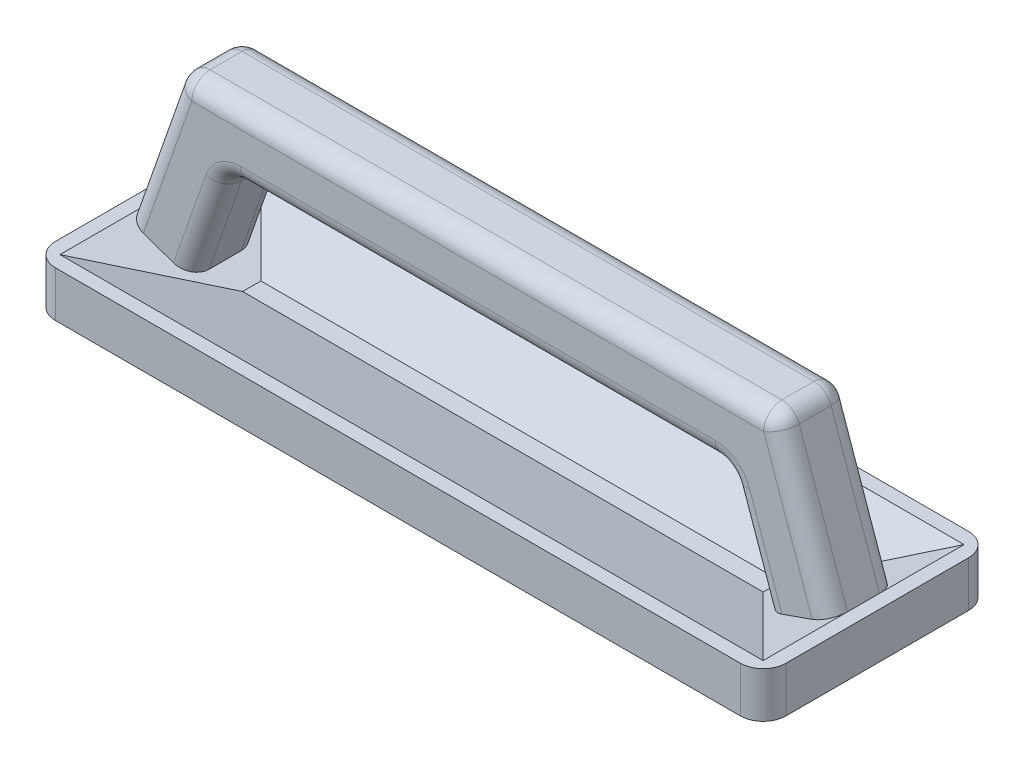
from build123d import *

# Parameters (mm, degrees)
SKETCH1_W                = 160
SKETCH1_H                = 50
BOSS_EXTRUDE1_DEPTH      = 10
SHELL3_T                 = -3
FILLET1_R                = 5
CHAMFER1_SIZE            = 7
CHAMFER1_SIZE_2          = 20
BOSS_EXTRUDE2_DEPTH      = 7.5
BOSS_EXTRUDE2_DEPTH_BACK = 7.5
FILLET2_R                = 4


with BuildPart() as part:
    # Sketch1 → Boss-Extrude1 (new body)
    with BuildSketch(Plane(origin=(0, 0, 0), x_dir=(1, 0, 0), z_dir=(0, 1, 0))):
        Rectangle(SKETCH1_W, SKETCH1_H)
    extrude(amount=BOSS_EXTRUDE1_DEPTH)

    # Shell3
    shell3_openings = [part.faces().sort_by_distance(p)[0] for p in [
        (0, 10, 0),
    ]]
    offset(amount=SHELL3_T, openings=shell3_openings, kind=Kind.INTERSECTION)

    # Fillet1
    fillet1_edges = [part.edges().sort_by_distance(p)[0] for p in [
        (80, 5, 25),
        (-80, 5, 25),
        (-80, 5, -25),
        (80, 5, -25),
    ]]
    fillet(fillet1_edges, radius=FILLET1_R)

    # Chamfer1
    # the kernel refuses this chamfer: 20, 7 mm, written as the material it adds along each edge
    with BuildSketch(Plane(origin=(-77, 3, 22), x_dir=(0, 0.9946410899892074, 0.10338811394488961), z_dir=(1, 0, 0))) as chamfer1_piece_1_section:
        Polygon((CHAMFER1_SIZE * 0.994641089989, -CHAMFER1_SIZE * 0.103388113945), (-CHAMFER1_SIZE_2 * 0.103388113945, -CHAMFER1_SIZE_2 * 0.994641089989), (0, 0), align=None)
    chamfer1_piece_1 = extrude(amount=154, mode=Mode.PRIVATE)
    chamfer1_piece_1 = split(chamfer1_piece_1, bisect_by=Plane(origin=(0, 10, 15.125023974), z_dir=(0, -1, 0)), keep=Keep.TOP, mode=Mode.PRIVATE)
    add(chamfer1_piece_1)
    with BuildSketch(Plane(origin=(-77, 3, -22), x_dir=(-0.10338811394489059, 0.9946410899892072, 0), z_dir=(0, 0, 1))) as chamfer1_piece_2_section:
        Polygon((CHAMFER1_SIZE * 0.994641089989, -CHAMFER1_SIZE * 0.103388113945), (-CHAMFER1_SIZE_2 * 0.103388113945, -CHAMFER1_SIZE_2 * 0.994641089989), (0, 0), align=None)
    chamfer1_piece_2 = extrude(amount=44, mode=Mode.PRIVATE)
    chamfer1_piece_2 = split(chamfer1_piece_2, bisect_by=Plane(origin=(-70.125023974, 10, 0), z_dir=(0, -1, 0)), keep=Keep.TOP, mode=Mode.PRIVATE)
    add(chamfer1_piece_2)
    with BuildSketch(Plane(origin=(77, 3, -22), x_dir=(0, 0.9946410899892074, -0.10338811394488961), z_dir=(-1, 0, 0))) as chamfer1_piece_3_section:
        Polygon((CHAMFER1_SIZE * 0.994641089989, -CHAMFER1_SIZE * 0.103388113945), (-CHAMFER1_SIZE_2 * 0.103388113945, -CHAMFER1_SIZE_2 * 0.994641089989), (0, 0), align=None)
    chamfer1_piece_3 = extrude(amount=154, mode=Mode.PRIVATE)
    chamfer1_piece_3 = split(chamfer1_piece_3, bisect_by=Plane(origin=(0, 10, -15.125023974), z_dir=(0, -1, 0)), keep=Keep.TOP, mode=Mode.PRIVATE)
    add(chamfer1_piece_3)
    with BuildSketch(Plane(origin=(77, 3, 22), x_dir=(0.10338811394489059, 0.9946410899892072, 0), z_dir=(0, 0, -1))) as chamfer1_piece_4_section:
        Polygon((CHAMFER1_SIZE * 0.994641089989, -CHAMFER1_SIZE * 0.103388113945), (-CHAMFER1_SIZE_2 * 0.103388113945, -CHAMFER1_SIZE_2 * 0.994641089989), (0, 0), align=None)
    chamfer1_piece_4 = extrude(amount=44, mode=Mode.PRIVATE)
    chamfer1_piece_4 = split(chamfer1_piece_4, bisect_by=Plane(origin=(70.125023974, 10, 0), z_dir=(0, -1, 0)), keep=Keep.TOP, mode=Mode.PRIVATE)
    add(chamfer1_piece_4)

    # Sketch2 → Boss-Extrude2 (add, two sides: drawn at the far end of the back side and taken through both)
    with BuildSketch(Plane.XY.offset(-BOSS_EXTRUDE2_DEPTH_BACK)):
        Polygon((-65.45, 43), (-77, 10), (-62.842124655, 5.044743629), (-54.807784925, 28), (54.807784925, 28), (62.842124655, 5.044743629), (77, 10), (65.45, 43), align=None)
    extrude(amount=BOSS_EXTRUDE2_DEPTH + BOSS_EXTRUDE2_DEPTH_BACK)

    # Fillet2
    fillet2_edges = [part.edges().sort_by_distance(p)[0] for p in [
        (54.807784925, 28, 0),
        (0, 28, -7.5),
        (-54.807784925, 28, 0),
        (-58.82495479, 16.522371815, -7.5),
        (-71.225, 26.5, 7.5),
        (-65.45, 43, 0),
        (0, 43, 7.5),
        (65.45, 43, 0),
        (71.225, 26.5, 7.5),
        (58.82495479, 16.522371815, -7.5),
        (-71.225, 26.5, -7.5),
        (0, 43, -7.5),
        (71.225, 26.5, -7.5),
        (0, 28, 7.5),
        (58.82495479, 16.522371815, 7.5),
        (-58.82495479, 16.522371815, 7.5),
    ]]
    fillet(fillet2_edges, radius=FILLET2_R)


solid = part.part
